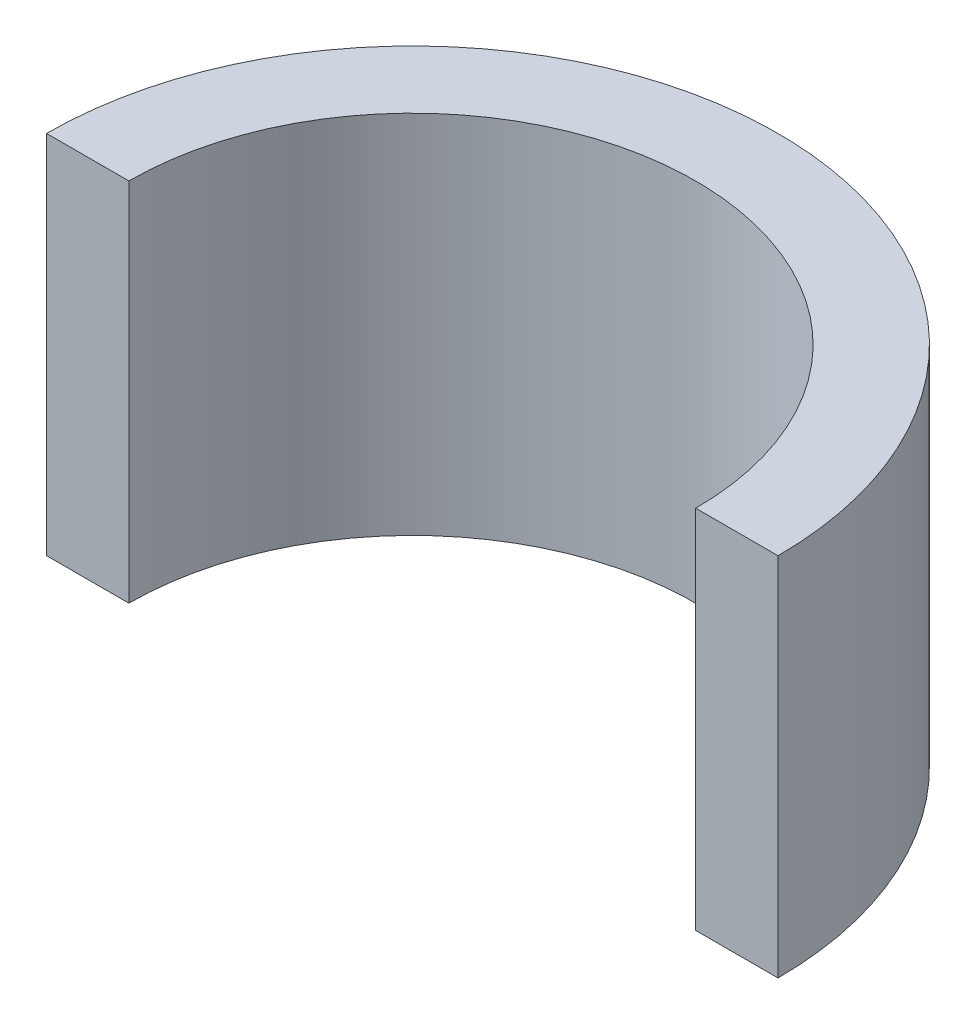
from build123d import *

# Parameters (mm, degrees)
BOSS_EXTRUDE1_DEPTH = 10


with BuildPart() as part:
    # Sketch1 → Boss-Extrude1 (new body)
    with BuildSketch(Plane(origin=(0, 0, 0), x_dir=(1, 0, 0), z_dir=(0, 1, 0))):
        with BuildLine():
            Line((-10, 0), (-7.75, 0))
            ThreePointArc((-7.75, 0), (0, 7.75), (7.75, 0))
            Line((7.75, 0), (10, 0))
            ThreePointArc((10, 0), (0, 10), (-10, 0))
        make_face()
    extrude(amount=BOSS_EXTRUDE1_DEPTH)


solid = part.part
